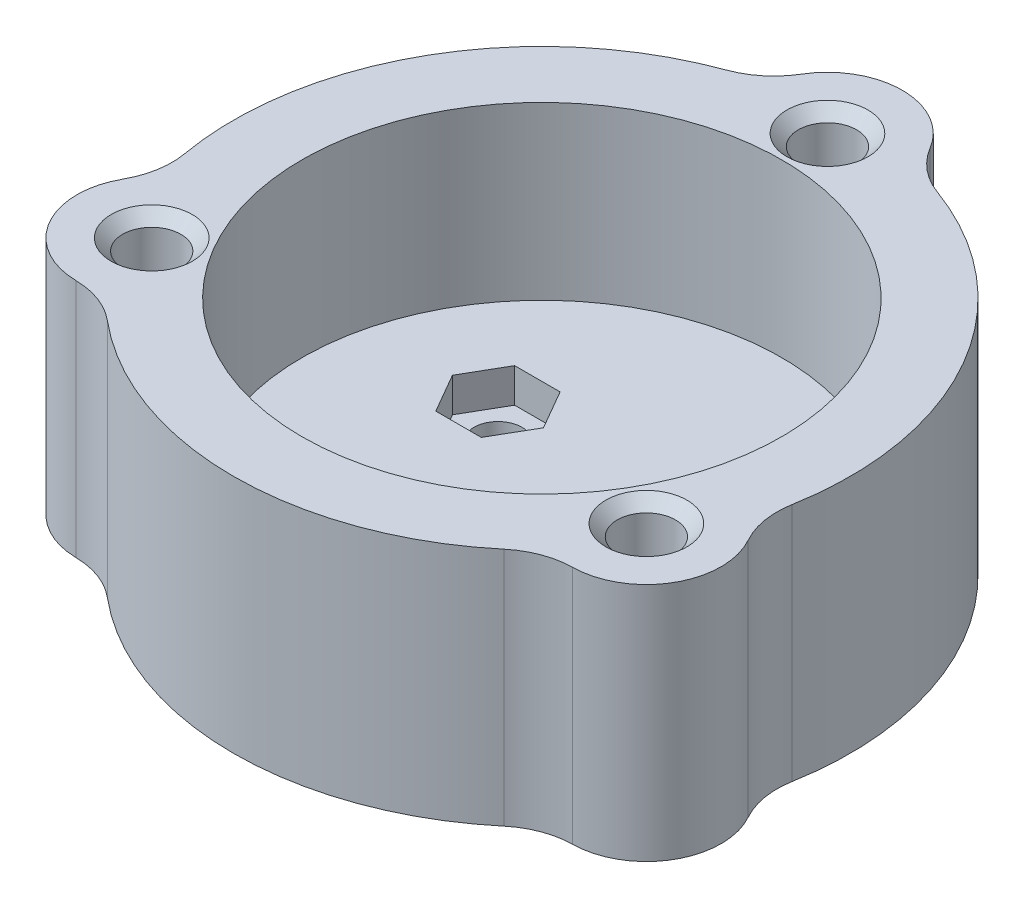
from build123d import *

# Parameters (mm, degrees)
SKETCH_1_R          = 2.55
SKETCH_1_R_2        = 21
EXTRUDE_1_DEPTH     = 15
EXTRUDE_START       = 6
EXTRUDE_2_DEPTH     = 6
FILLET_1_R          = 7
CHAMFER_1_SIZE      = 1
SKETCH_3_R          = 2.1
CUT_EXTRUDE_1_DEPTH = 48.24064284
CUT_EXTRUDE_2_DEPTH = 3


with BuildPart() as part:
    # Эскиз1 → Бобышка-Вытянуть1 (new body)
    with BuildSketch(Plane(origin=(0, 0, 0), x_dir=(1, 0, 0), z_dir=(0, 1, 0))):
        with BuildLine():
            ThreePointArc((6.435008795, 26.22195), (0, 31.55), (-6.435008795, 26.22195))
            ThreePointArc((-6.435008795, 26.22195), (-23.382685902, 13.5), (-25.926379234, -7.53809391))
            ThreePointArc((-25.926379234, -7.53809391), (-27.323101489, -15.775), (-19.491370439, -18.68385609))
            ThreePointArc((-19.491370439, -18.68385609), (0, -27), (19.491370439, -18.68385609))
            ThreePointArc((19.491370439, -18.68385609), (27.323101489, -15.775), (25.926379234, -7.53809391))
            ThreePointArc((25.926379234, -7.53809391), (23.382685902, 13.5), (6.435008795, 26.22195))
        make_face()
        with Locations((0, 25)):
            Circle(SKETCH_1_R, mode=Mode.SUBTRACT)
        Circle(SKETCH_1_R_2, mode=Mode.SUBTRACT)
        with Locations((21.650635095, -12.5)):
            Circle(SKETCH_1_R, mode=Mode.SUBTRACT)
        with Locations((-21.650635095, -12.5)):
            Circle(SKETCH_1_R, mode=Mode.SUBTRACT)
    extrude(amount=EXTRUDE_1_DEPTH)

    # Эскиз2 → Бобышка-Вытянуть2 (add)
    with BuildSketch(Plane.XZ.offset(EXTRUDE_START)):
        with BuildLine():
            ThreePointArc((25.926379234, 7.53809391), (27.323101489, 15.775), (19.491370439, 18.68385609))
            ThreePointArc((19.491370439, 18.68385609), (0, 27), (-19.491370439, 18.68385609))
            ThreePointArc((-19.491370439, 18.68385609), (-27.323101489, 15.775), (-25.926379234, 7.53809391))
            ThreePointArc((-25.926379234, 7.53809391), (-23.382685902, -13.5), (-6.435008795, -26.22195))
            ThreePointArc((-6.435008795, -26.22195), (0, -31.55), (6.435008795, -26.22195))
            ThreePointArc((6.435008795, -26.22195), (23.382685902, -13.5), (25.926379234, 7.53809391))
        make_face()
    extrude(amount=-EXTRUDE_2_DEPTH)

    # Скругление1
    fillet_1_edges = [part.edges().sort_by_distance(p)[0] for p in [
        (6.435008795, 4.5, -26.22195),
        (-6.435008795, 4.5, -26.22195),
        (-25.926379234, 4.5, 7.53809391),
        (-19.491370439, 4.5, 18.68385609),
        (19.491370439, 4.5, 18.68385609),
        (25.926379234, 4.5, 7.53809391),
    ]]
    fillet(fillet_1_edges, radius=FILLET_1_R)

    # Фаска1
    chamfer_1_edges = [part.edges().sort_by_distance(p)[0] for p in [
        (-2.55, 15, -25),
        (19.100635095, 15, 12.5),
        (-24.200635095, 15, 12.5),
    ]]
    chamfer(chamfer_1_edges, length=CHAMFER_1_SIZE)

    # Эскиз3 → Вырез-Вытянуть1 (cut, through all)
    with BuildSketch(Plane.XZ.offset(6)):
        with Locations((0, 10.5)):
            Circle(SKETCH_3_R)
        with Locations((9.09326674, -5.25)):
            Circle(SKETCH_3_R)
        with Locations((-9.09326674, -5.25)):
            Circle(SKETCH_3_R)
    extrude(amount=-CUT_EXTRUDE_1_DEPTH, mode=Mode.SUBTRACT)

    # Эскиз4 → Вырез-Вытянуть2 (cut)
    with BuildSketch(Plane(origin=(0, 0, 0), x_dir=(1, 0, 0), z_dir=(0, 1, 0))):
        Polygon((-3.983716857, -10.5), (-1.991858429, -13.95), (1.991858429, -13.95), (3.983716857, -10.5), (1.991858429, -7.05), (-1.991858429, -7.05), align=None)
        Polygon((11.085125168, 1.8), (13.076983597, 5.25), (11.085125168, 8.7), (7.101408311, 8.7), (5.109549882, 5.25), (7.101408311, 1.8), align=None)
        Polygon((-7.101408311, 8.7), (-11.085125168, 8.7), (-13.076983597, 5.25), (-11.085125168, 1.8), (-7.101408311, 1.8), (-5.109549882, 5.25), align=None)
    extrude(amount=-CUT_EXTRUDE_2_DEPTH, mode=Mode.SUBTRACT)


solid = part.part
